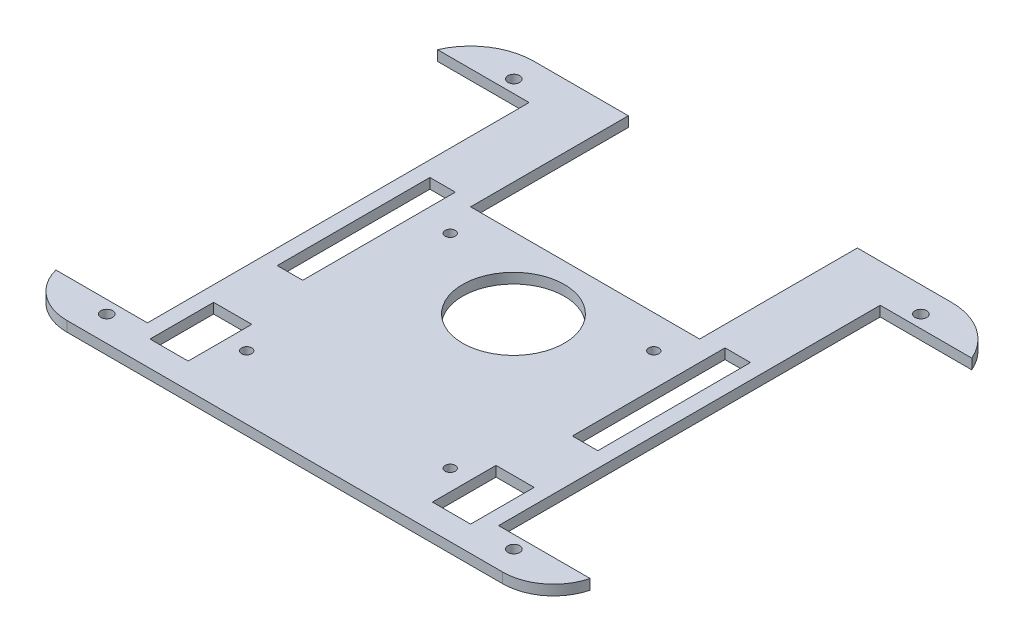
from build123d import *

# Parameters (mm, degrees)
SKETCH1_R           = 20
SKETCH1_R_2         = 2.32
SKETCH1_R_3         = 2
SKETCH1_W           = 10
SKETCH1_H           = 60
SKETCH1_W_2         = 15
SKETCH1_H_2         = 25
BOSS_EXTRUDE1_DEPTH = 4
FILLET2_R           = 20
FILLET3_R           = 25


with BuildPart() as part:
    # Sketch1 → Boss-Extrude1 (new body)
    with BuildSketch(Plane(origin=(0, 0, 0), x_dir=(1, 0, 0), z_dir=(0, 1, 0))):
        Polygon((-150, 43.493460664), (-114, 43.493460664), (-114, -106.506539336), (-150, -106.506539336), (-150, -121.506539336), (60, -121.506539336), (60, -106.506539336), (24, -106.506539336), (24, 43.493460664), (60, 43.493460664), (60, 58.493460664), (0, 58.493460664), (0, -3.506539336), (-90, -3.506539336), (-90, 58.493460664), (-150, 58.493460664), align=None)
        with Locations(Location((-45.147898231, -31.506539336, 0), (0, 0, 270))):
            Circle(SKETCH1_R, mode=Mode.SUBTRACT)
        with Locations(Location((-125, -111.506539336, 0), (0, 0, 270))):
            Circle(SKETCH1_R_2, mode=Mode.SUBTRACT)
        with Locations(Location((-125, 48.493460664, 0), (0, 0, 90))):
            Circle(SKETCH1_R_2, mode=Mode.SUBTRACT)
        with Locations(Location((35, 48.493460664, 0), (0, 0, 270))):
            Circle(SKETCH1_R_2, mode=Mode.SUBTRACT)
        with Locations(Location((35, -111.506539336, 0), (0, 0, 90))):
            Circle(SKETCH1_R_2, mode=Mode.SUBTRACT)
        with Locations(Location((-85, -96.506539336, 0), (0, 0, 270))):
            Circle(SKETCH1_R_3, mode=Mode.SUBTRACT)
        with Locations(Location((-5, -96.506539336, 0), (0, 0, 90))):
            Circle(SKETCH1_R_3, mode=Mode.SUBTRACT)
        with Locations(Location((-85, -16.506539336, 0), (0, 0, 90))):
            Circle(SKETCH1_R_3, mode=Mode.SUBTRACT)
        with Locations(Location((-5, -16.506539336, 0), (0, 0, 270))):
            Circle(SKETCH1_R_3, mode=Mode.SUBTRACT)
        with Locations((13, -31.506539336)):
            Rectangle(SKETCH1_W, SKETCH1_H, mode=Mode.SUBTRACT)
        with Locations((-103, -31.506539336)):
            Rectangle(SKETCH1_W, SKETCH1_H, mode=Mode.SUBTRACT)
        with Locations((10.5, -99.006539336)):
            Rectangle(SKETCH1_W_2, SKETCH1_H_2, mode=Mode.SUBTRACT)
        with Locations((-100.5, -99.006539336)):
            Rectangle(SKETCH1_W_2, SKETCH1_H_2, mode=Mode.SUBTRACT)
    extrude(amount=BOSS_EXTRUDE1_DEPTH)

    # Fillet2
    # the kernel refuses this fillet: 20 mm, written as the material it takes off along each edge
    with BuildSketch(Plane(origin=(60, -48.412291828, 121.506539336), x_dir=(-1, 0, 0), z_dir=(0, 1, 0))) as fillet2_piece_1:
        with BuildLine():
            CenterArc((19.364916731, -20), FILLET2_R, 90, 75.522487814)
            Line((0, -15), (-0.387298335, -14.9))
            ThreePointArc((-0.387298335, -14.9), (-0.4, -7.5), (-0.4, 0))
            Line((-0.4, 0), (0, 0.4))
            Line((0, 0.4), (19.364916731, 0.4))
            Line((19.364916731, 0.4), (19.364916731, 0))
        make_face()
    extrude(amount=100.824583655, mode=Mode.SUBTRACT)
    with BuildSketch(Plane(origin=(-150, -48.412291828, 121.506539336), x_dir=(0, 0, -1), z_dir=(0, 1, 0))) as fillet2_piece_2:
        with BuildLine():
            CenterArc((20, -19.364916731), FILLET2_R, 104.477512186, 75.522487814)
            Line((0, -19.364916731), (-0.4, -19.364916731))
            Line((-0.4, -19.364916731), (-0.4, 0))
            Line((-0.4, 0), (0, 0.4))
            ThreePointArc((0, 0.4), (7.5, 0.4), (14.9, 0.387298335))
            Line((14.9, 0.387298335), (15, 0))
        make_face()
    extrude(amount=100.824583655, mode=Mode.SUBTRACT)

    # Fillet3
    # the kernel refuses this fillet: 25 mm, written as the material it takes off along each edge
    with BuildSketch(Plane(origin=(60, -57.282196187, -58.493460664), x_dir=(-1, 0, 0), z_dir=(0, 1, 0))) as fillet3_piece_1:
        with BuildLine():
            CenterArc((22.912878475, 25), FILLET3_R, 203.578178478, 66.421821522)
            Line((0, 15), (-0.458257569, 14.8))
            ThreePointArc((-0.458257569, 14.8), (-0.5, 7.5), (-0.5, 0))
            Line((-0.5, 0), (0, -0.5))
            Line((0, -0.5), (22.912878475, -0.5))
            Line((22.912878475, -0.5), (22.912878475, 0))
        make_face()
    extrude(amount=118.564392374, mode=Mode.SUBTRACT)
    with BuildSketch(Plane(origin=(-150, -57.282196187, -58.493460664), x_dir=(0, 0, 1), z_dir=(0, 1, 0))) as fillet3_piece_2:
        with BuildLine():
            CenterArc((25, 22.912878475), FILLET3_R, 180, 66.421821522)
            Line((0, 22.912878475), (-0.5, 22.912878475))
            Line((-0.5, 22.912878475), (-0.5, 0))
            Line((-0.5, 0), (0, -0.5))
            ThreePointArc((0, -0.5), (7.5, -0.5), (14.8, -0.458257569))
            Line((14.8, -0.458257569), (15, 0))
        make_face()
    extrude(amount=118.564392374, mode=Mode.SUBTRACT)


solid = part.part
